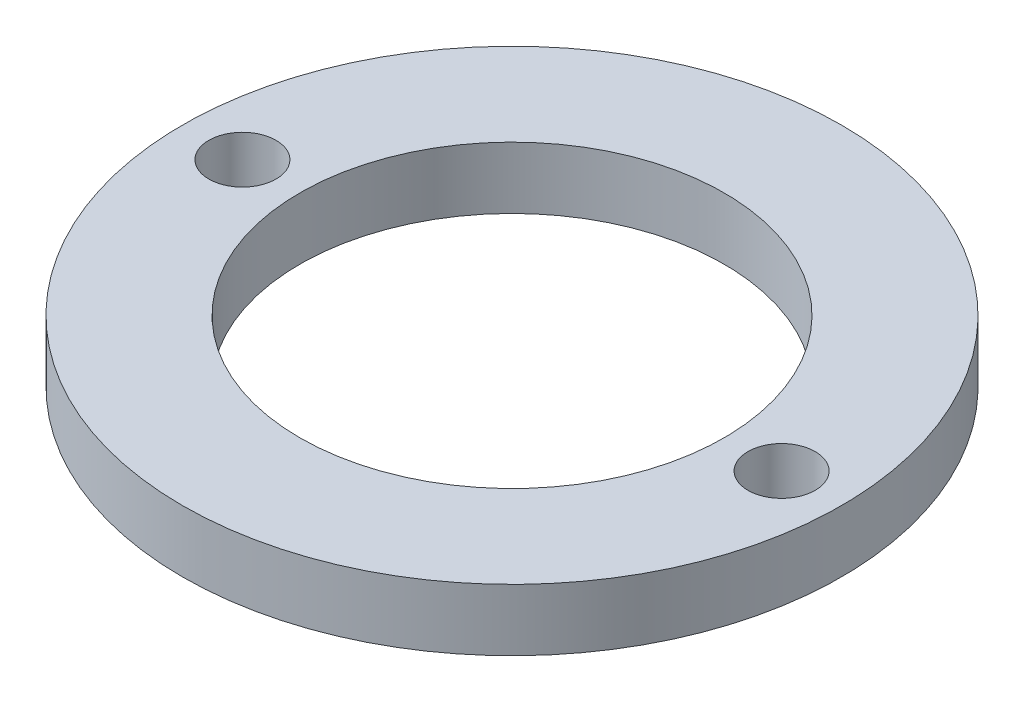
from build123d import *

# Parameters (mm, degrees)
SKETCH1_R             = 16
SKETCH1_R_2           = 10.3
BOSS_EXTRUDE1_DEPTH   = 3
F_4_CLEARANCE_HOLE1_D = 3.2639


with BuildPart() as part:
    # Sketch1 → Boss-Extrude1 (new body)
    with BuildSketch(Plane(origin=(0, 0, 0), x_dir=(1, 0, 0), z_dir=(0, 1, 0))):
        Circle(SKETCH1_R)
        Circle(SKETCH1_R_2, mode=Mode.SUBTRACT)
    extrude(amount=BOSS_EXTRUDE1_DEPTH)

    # #4 Clearance Hole1 (through all)
    with Locations(Plane(origin=(0, 3, 0), x_dir=(1, 0, 0), z_dir=(0, 1, 0))):
        with Locations((-13.0875, 0), (13.0875, 0)):
            Hole(F_4_CLEARANCE_HOLE1_D / 2)


solid = part.part
